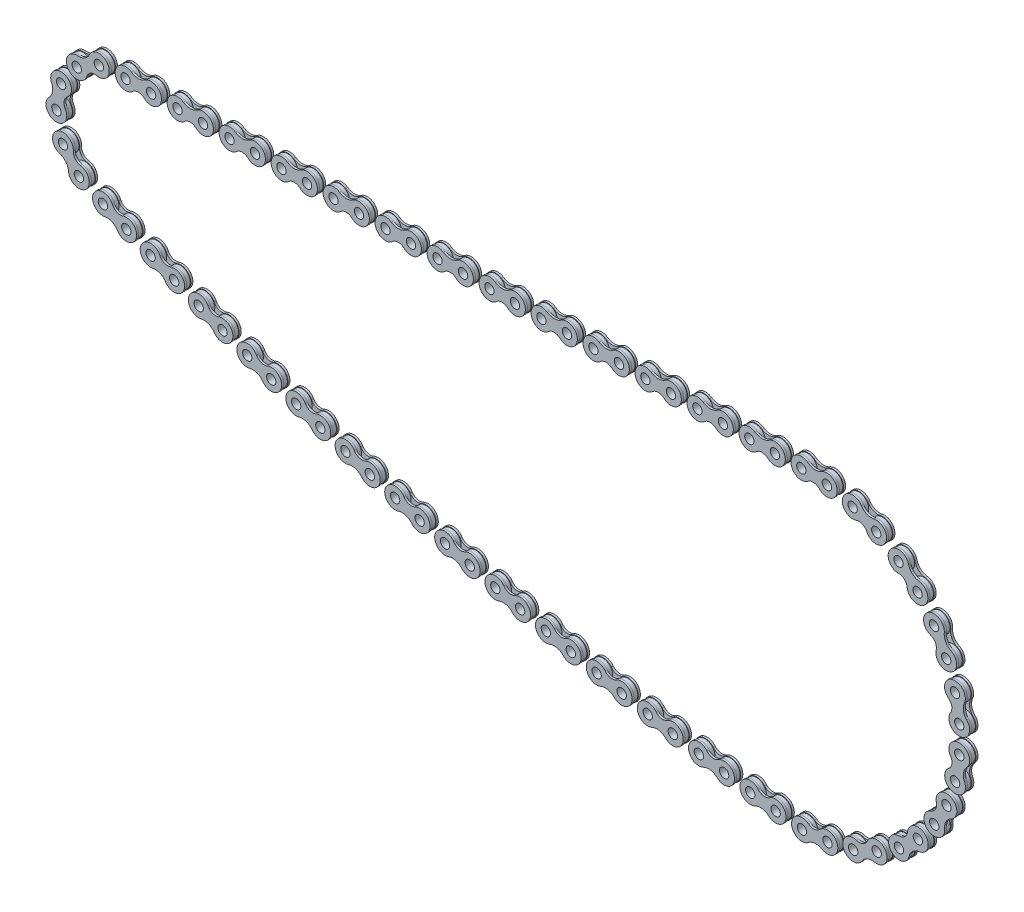
from build123d import *

# Parameters (mm, degrees)
SKETCH1_R             = 4.75
SKETCH1_R_2           = 2.25
BOSS_EXTRUDE2_DEPTH   = 1
BOSS_EXTRUDE2_2_DEPTH = 1
SKETCH4_R             = 2.25
BOSS_EXTRUDE3_DEPTH   = 1
CRVPATTERN1_5_ANGLE   = 3.8901012
CRVPATTERN1_6_ANGLE   = 23.0027709
CRVPATTERN1_7_ANGLE   = 42.1154406
CRVPATTERN1_8_ANGLE   = 61.2281103
CRVPATTERN1_9_ANGLE   = 80.34078
CRVPATTERN1_10_ANGLE  = 99.4534497
CRVPATTERN1_11_ANGLE  = 118.5661194
CRVPATTERN1_12_ANGLE  = 137.6787891
CRVPATTERN1_13_ANGLE  = 156.7914588
CRVPATTERN1_14_ANGLE  = 175.9041285
CRVPATTERN1_15_ANGLE  = 172.3357403
CRVPATTERN1_16_ANGLE  = 171.095109
CRVPATTERN1_17_ANGLE  = 169.8544777
CRVPATTERN1_18_ANGLE  = 168.6138464
CRVPATTERN1_19_ANGLE  = 167.3732151
CRVPATTERN1_20_ANGLE  = 166.1325838
CRVPATTERN1_21_ANGLE  = 164.8919525
CRVPATTERN1_22_ANGLE  = 163.6513212
CRVPATTERN1_23_ANGLE  = 162.4106898
CRVPATTERN1_24_ANGLE  = 161.1700585
CRVPATTERN1_25_ANGLE  = 159.9294272
CRVPATTERN1_26_ANGLE  = 158.6887959
CRVPATTERN1_27_ANGLE  = 157.4481646
CRVPATTERN1_28_ANGLE  = 156.2075333
CRVPATTERN1_29_ANGLE  = 128.6116148
CRVPATTERN1_30_ANGLE  = 79.3521569
CRVPATTERN1_31_ANGLE  = 30.0926989


with BuildPart() as part:
    # Sketch1 → Boss-Extrude2 (new, symmetric)
    with BuildSketch(Plane.XY):
        with Locations((-6.15, 0)):
            Circle(SKETCH1_R)
        with Locations((-6.15, 0)):
            Circle(SKETCH1_R_2, mode=Mode.SUBTRACT)
    extrude(amount=BOSS_EXTRUDE2_DEPTH, both=True)



with BuildPart() as body_2:
    # Sketch1 → Boss-Extrude2 2 (new, symmetric)
    with BuildSketch(Plane.XY):
        with Locations(Location((6.15, 0, 0), (0, 0, 180))):
            Circle(SKETCH1_R)
        with Locations((6.15, 0)):
            Circle(SKETCH1_R_2, mode=Mode.SUBTRACT)
    extrude(amount=BOSS_EXTRUDE2_2_DEPTH, both=True)


with BuildPart() as part_1:
    add(part.part)

    add(body_2.part)  # Boss-Extrude3 merges body 2
    # Sketch4 → Boss-Extrude3 (add)
    with BuildSketch(Plane.XY.offset(1)):
        with BuildLine():
            ThreePointArc((-3.306545715, 4.112756707), (-11.138190791, -0.343442335), (-2.769713678, -3.684245429))
            ThreePointArc((-2.769713678, -3.684245429), (0, -2.606152308), (2.769713678, -3.684245429))
            ThreePointArc((2.769713678, -3.684245429), (11.138190791, -0.343442335), (3.306545715, 4.112756707))
            ThreePointArc((3.306545715, 4.112756707), (0, 3.081014953), (-3.306545715, 4.112756707))
        make_face()
        with Locations((6.15, 0)):
            Circle(SKETCH4_R, mode=Mode.SUBTRACT)
        with Locations((-6.15, 0)):
            Circle(SKETCH4_R, mode=Mode.SUBTRACT)
    extrude(amount=BOSS_EXTRUDE3_DEPTH)

    # Mirror1: part across plane


with BuildPart() as part_2:
    add(part_1.part)
    add(part_1.part.mirror(Plane.XY))


with BuildPart() as body_2_2:
    # CrvPattern1: read off the stored shape, not the designer's step
    # CrvPattern1: copy of part
    add(part_2.part.moved(Location((25.0184261, 0, 0))))


with BuildPart() as body_3:
    # CrvPattern1 2: copy of part
    add(part_2.part.moved(Location((50.0368522, 0, 0))))


with BuildPart() as body_4:
    # CrvPattern1 3: copy of part
    add(part_2.part.moved(Location((75.0552784, 0, 0))))


with BuildPart() as body_5:
    # CrvPattern1 4: copy of part
    add(part_2.part.moved(Location((100.0737045, 0, 0))))


with BuildPart() as body_6:
    # CrvPattern1 5: copy of part
    add(part_2.part.moved(Location((124.8091764, 8.3138627, 0))).rotate(Axis((0, 0, 0), (0, 0, -1)), CRVPATTERN1_5_ANGLE))


with BuildPart() as body_7:
    # CrvPattern1 6: copy of part
    add(part_2.part.moved(Location((139.7517156, 52.8536249, 0))).rotate(Axis((0, 0, 0), (0, 0, -1)), CRVPATTERN1_6_ANGLE))


with BuildPart() as body_8:
    # CrvPattern1 7: copy of part
    add(part_2.part.moved(Location((139.2870563, 99.8307894, 0))).rotate(Axis((0, 0, 0), (0, 0, -1)), CRVPATTERN1_7_ANGLE))


with BuildPart() as body_9:
    # CrvPattern1 8: copy of part
    add(part_2.part.moved(Location((123.466426, 144.0662678, 0))).rotate(Axis((0, 0, 0), (0, 0, -1)), CRVPATTERN1_8_ANGLE))


with BuildPart() as body_10:
    # CrvPattern1 9: copy of part
    add(part_2.part.moved(Location((94.0340004, 180.6832342, 0))).rotate(Axis((0, 0, 0), (0, 0, -1)), CRVPATTERN1_9_ANGLE))


with BuildPart() as body_11:
    # CrvPattern1 10: copy of part
    add(part_2.part.moved(Location((54.2346145, 205.6447801, 0))).rotate(Axis((0, 0, 0), (0, 0, -1)), CRVPATTERN1_10_ANGLE))


with BuildPart() as body_12:
    # CrvPattern1 11: copy of part
    add(part_2.part.moved(Location((8.4560284, 216.1989716, 0))).rotate(Axis((0, 0, 0), (0, 0, -1)), CRVPATTERN1_11_ANGLE))


with BuildPart() as body_13:
    # CrvPattern1 12: copy of part
    add(part_2.part.moved(Location((-38.2548088, 211.1822415, 0))).rotate(Axis((0, 0, 0), (0, 0, -1)), CRVPATTERN1_12_ANGLE))


with BuildPart() as body_14:
    # CrvPattern1 13: copy of part
    add(part_2.part.moved(Location((-80.7481706, 191.1476689, 0))).rotate(Axis((0, 0, 0), (0, 0, -1)), CRVPATTERN1_13_ANGLE))


with BuildPart() as body_15:
    # CrvPattern1 14: copy of part
    add(part_2.part.moved(Location((-114.339294, 158.304004, 0))).rotate(Axis((0, 0, 0), (0, 0, -1)), CRVPATTERN1_14_ANGLE))


with BuildPart() as body_16:
    # CrvPattern1 15: copy of part
    add(part_2.part.moved(Location((-119.3012253, 133.293433, 0))).rotate(Axis((0, 0, 0), (0, 0, 1)), CRVPATTERN1_15_ANGLE))


with BuildPart() as body_17:
    # CrvPattern1 16: copy of part
    add(part_2.part.moved(Location((-97.1435968, 130.9499906, 0))).rotate(Axis((0, 0, 0), (0, 0, 1)), CRVPATTERN1_16_ANGLE))


with BuildPart() as body_18:
    # CrvPattern1 17: copy of part
    add(part_2.part.moved(Location((-74.9404236, 129.0868415, 0))).rotate(Axis((0, 0, 0), (0, 0, 1)), CRVPATTERN1_17_ANGLE))


with BuildPart() as body_19:
    # CrvPattern1 18: copy of part
    add(part_2.part.moved(Location((-52.7021155, 127.7048591, 0))).rotate(Axis((0, 0, 0), (0, 0, 1)), CRVPATTERN1_18_ANGLE))


with BuildPart() as body_20:
    # CrvPattern1 19: copy of part
    add(part_2.part.moved(Location((-30.4390986, 126.8046913, 0))).rotate(Axis((0, 0, 0), (0, 0, 1)), CRVPATTERN1_19_ANGLE))


with BuildPart() as body_21:
    # CrvPattern1 20: copy of part
    add(part_2.part.moved(Location((-8.1618107, 126.3867603, 0))).rotate(Axis((0, 0, 0), (0, 0, 1)), CRVPATTERN1_20_ANGLE))


with BuildPart() as body_22:
    # CrvPattern1 21: copy of part
    add(part_2.part.moved(Location((14.1193038, 126.4512619, 0))).rotate(Axis((0, 0, 0), (0, 0, 1)), CRVPATTERN1_21_ANGLE))


with BuildPart() as body_23:
    # CrvPattern1 22: copy of part
    add(part_2.part.moved(Location((36.3937987, 126.998166, 0))).rotate(Axis((0, 0, 0), (0, 0, 1)), CRVPATTERN1_22_ANGLE))


with BuildPart() as body_24:
    # CrvPattern1 23: copy of part
    add(part_2.part.moved(Location((58.6512307, 128.027216, 0))).rotate(Axis((0, 0, 0), (0, 0, 1)), CRVPATTERN1_23_ANGLE))


with BuildPart() as body_25:
    # CrvPattern1 24: copy of part
    add(part_2.part.moved(Location((80.8811647, 129.5379295, 0))).rotate(Axis((0, 0, 0), (0, 0, 1)), CRVPATTERN1_24_ANGLE))


with BuildPart() as body_26:
    # CrvPattern1 25: copy of part
    add(part_2.part.moved(Location((103.0731786, 131.5295984, 0))).rotate(Axis((0, 0, 0), (0, 0, 1)), CRVPATTERN1_25_ANGLE))


with BuildPart() as body_27:
    # CrvPattern1 26: copy of part
    add(part_2.part.moved(Location((125.2168678, 134.0012887, 0))).rotate(Axis((0, 0, 0), (0, 0, 1)), CRVPATTERN1_26_ANGLE))


with BuildPart() as body_28:
    # CrvPattern1 27: copy of part
    add(part_2.part.moved(Location((147.3018505, 136.9518416, 0))).rotate(Axis((0, 0, 0), (0, 0, 1)), CRVPATTERN1_27_ANGLE))


with BuildPart() as body_29:
    # CrvPattern1 28: copy of part
    add(part_2.part.moved(Location((169.3177724, 140.3798739, 0))).rotate(Axis((0, 0, 0), (0, 0, 1)), CRVPATTERN1_28_ANGLE))


with BuildPart() as body_30:
    # CrvPattern1 29: copy of part
    add(part_2.part.moved(Location((108.2653387, 211.1986681, 0))).rotate(Axis((0, 0, 0), (0, 0, 1)), CRVPATTERN1_29_ANGLE))


with BuildPart() as body_31:
    # CrvPattern1 30: copy of part
    add(part_2.part.moved(Location((-67.342121, 229.9604708, 0))).rotate(Axis((0, 0, 0), (0, 0, 1)), CRVPATTERN1_30_ANGLE))


with BuildPart() as body_32:
    # CrvPattern1 31: copy of part
    add(part_2.part.moved(Location((-196.1649473, 109.1520912, 0))).rotate(Axis((0, 0, 0), (0, 0, 1)), CRVPATTERN1_31_ANGLE))


with BuildPart() as body_33:
    # CrvPattern1 32: copy of part
    add(part_2.part.moved(Location((-200.147409, 0, 0))))


with BuildPart() as body_34:
    # CrvPattern1 33: copy of part
    add(part_2.part.moved(Location((-175.1289829, 0, 0))))


with BuildPart() as body_35:
    # CrvPattern1 34: copy of part
    add(part_2.part.moved(Location((-150.1105567, 0, 0))))


with BuildPart() as body_36:
    # CrvPattern1 35: copy of part
    add(part_2.part.moved(Location((-125.0921306, 0, 0))))


with BuildPart() as body_37:
    # CrvPattern1 36: copy of part
    add(part_2.part.moved(Location((-100.0737045, 0, 0))))


with BuildPart() as body_38:
    # CrvPattern1 37: copy of part
    add(part_2.part.moved(Location((-75.0552784, 0, 0))))


with BuildPart() as body_39:
    # CrvPattern1 38: copy of part
    add(part_2.part.moved(Location((-50.0368522, 0, 0))))


with BuildPart() as body_40:
    # CrvPattern1 39: copy of part
    add(part_2.part.moved(Location((-25.0184261, 0, 0))))


solid = Compound([part_2.part, body_2_2.part, body_3.part, body_4.part, body_5.part, body_6.part, body_7.part, body_8.part, body_9.part, body_10.part, body_11.part, body_12.part, body_13.part, body_14.part, body_15.part, body_16.part, body_17.part, body_18.part, body_19.part, body_20.part, body_21.part, body_22.part, body_23.part, body_24.part, body_25.part, body_26.part, body_27.part, body_28.part, body_29.part, body_30.part, body_31.part, body_32.part, body_33.part, body_34.part, body_35.part, body_36.part, body_37.part, body_38.part, body_39.part, body_40.part])
